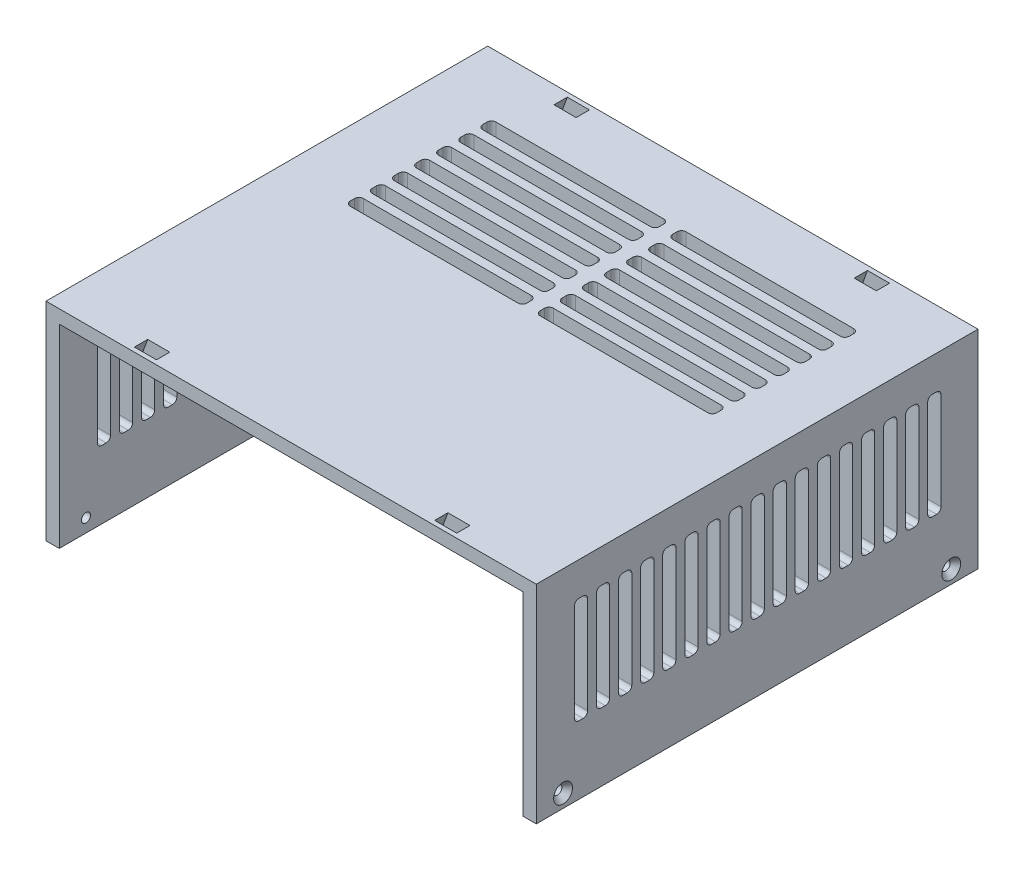
from build123d import *

# Parameters (mm, degrees)
SKETCH1_W                                         = 111
SKETCH1_H                                         = 100
BOSS_EXTRUDE1_DEPTH                               = 47
SKETCH2_W                                         = 105
SKETCH2_H                                         = 44
CUT_EXTRUDE2_DEPTH                                = 124.649706833
CSK_FOR_1_FLAT_HEAD_SOCKET_CAP_SCREW1_D           = 2.0574
CSK_FOR_1_FLAT_HEAD_SOCKET_CAP_SCREW1_DEPTH       = 3
CSK_FOR_1_FLAT_HEAD_SOCKET_CAP_SCREW1_CSINK_D     = 4.2672
CSK_FOR_1_FLAT_HEAD_SOCKET_CAP_SCREW1_CSINK_ANGLE = 82
CUT_EXTRUDE6_DEPTH                                = 131.499042142
CUT_EXTRUDE7_DEPTH                                = 89.256727789
CUT_LOFT2_START                                   = -49
CUT_LOFT2_DEPTH                                   = 3
MIRROR2_START                                     = -49
MIRROR2_AT_THE_SECOND_PLANE_COPY_1_DEPTH          = 3


# Read off the part's stored shape, not the designer's step: Cut-Loft2
with BuildPart() as part:
    # Sketch1 → Boss-Extrude1 (new body)
    with BuildSketch(Plane(origin=(0, 0, 0), x_dir=(1, 0, 0), z_dir=(0, 1, 0))):
        Rectangle(SKETCH1_W, SKETCH1_H)
    extrude(amount=BOSS_EXTRUDE1_DEPTH)

    # Sketch2 → Cut-Extrude2 (cut, through all)
    with BuildSketch(Plane.XY.offset(50)):
        with Locations((0, 22)):
            Rectangle(SKETCH2_W, SKETCH2_H)
    extrude(amount=-CUT_EXTRUDE2_DEPTH, mode=Mode.SUBTRACT)

    # CSK for #1 Flat Head Socket Cap Screw1
    with Locations(Plane.ZY.offset(55.5)):
        with Locations((-43.94, 3), (43.94, 3)):
            csk_for_1_flat_head_socket_cap_screw1 = CounterSinkHole(CSK_FOR_1_FLAT_HEAD_SOCKET_CAP_SCREW1_D / 2, CSK_FOR_1_FLAT_HEAD_SOCKET_CAP_SCREW1_CSINK_D / 2, depth=CSK_FOR_1_FLAT_HEAD_SOCKET_CAP_SCREW1_DEPTH, counter_sink_angle=CSK_FOR_1_FLAT_HEAD_SOCKET_CAP_SCREW1_CSINK_ANGLE)

    # Mirror1: CSK for #1 Flat Head Socket Cap Screw1 across plane
    add(csk_for_1_flat_head_socket_cap_screw1.mirror(Plane(origin=(0, 0, 0), x_dir=(0, 0, 1), z_dir=(1, 0, 0))), mode=Mode.SUBTRACT)

    # Sketch4 → Cut-Extrude6 (cut, through all)
    with BuildSketch(Plane.ZY.offset(55.5)):
        with BuildLine():
            Line((-36.616046788, 38.392706908), (-36.616046788, 16.392706908))
            ThreePointArc((-36.616046788, 16.392706908), (-36.323153569, 15.685600127), (-35.616046788, 15.392706908))
            Line((-35.616046788, 15.392706908), (-34.616046788, 15.392706908))
            ThreePointArc((-34.616046788, 15.392706908), (-33.908940007, 15.685600127), (-33.616046788, 16.392706908))
            Line((-33.616046788, 16.392706908), (-33.616046788, 38.392706908))
            ThreePointArc((-33.616046788, 38.392706908), (-33.908940007, 39.099813689), (-34.616046788, 39.392706908))
            Line((-34.616046788, 39.392706908), (-35.616046788, 39.392706908))
            ThreePointArc((-35.616046788, 39.392706908), (-36.323153569, 39.099813689), (-36.616046788, 38.392706908))
        make_face()
        with BuildLine():
            Line((-40.616046788, 39.392706908), (-39.616046788, 39.392706908))
            ThreePointArc((-39.616046788, 39.392706908), (-38.908940007, 39.099813689), (-38.616046788, 38.392706908))
            Line((-38.616046788, 38.392706908), (-38.616046788, 16.392706908))
            ThreePointArc((-38.616046788, 16.392706908), (-38.908940007, 15.685600127), (-39.616046788, 15.392706908))
            Line((-39.616046788, 15.392706908), (-40.616046788, 15.392706908))
            ThreePointArc((-40.616046788, 15.392706908), (-41.323153569, 15.685600127), (-41.616046788, 16.392706908))
            Line((-41.616046788, 16.392706908), (-41.616046788, 38.392706908))
            ThreePointArc((-41.616046788, 38.392706908), (-41.323153569, 39.099813689), (-40.616046788, 39.392706908))
        make_face()
        with BuildLine():
            Line((-31.616046788, 38.392706908), (-31.616046788, 16.392706908))
            ThreePointArc((-31.616046788, 16.392706908), (-31.323153569, 15.685600127), (-30.616046788, 15.392706908))
            Line((-30.616046788, 15.392706908), (-29.616046788, 15.392706908))
            ThreePointArc((-29.616046788, 15.392706908), (-28.908940007, 15.685600127), (-28.616046788, 16.392706908))
            Line((-28.616046788, 16.392706908), (-28.616046788, 38.392706908))
            ThreePointArc((-28.616046788, 38.392706908), (-28.908940007, 39.099813689), (-29.616046788, 39.392706908))
            Line((-29.616046788, 39.392706908), (-30.616046788, 39.392706908))
            ThreePointArc((-30.616046788, 39.392706908), (-31.323153569, 39.099813689), (-31.616046788, 38.392706908))
        make_face()
        with BuildLine():
            Line((-26.616046788, 38.392706908), (-26.616046788, 16.392706908))
            ThreePointArc((-26.616046788, 16.392706908), (-26.323153569, 15.685600127), (-25.616046788, 15.392706908))
            Line((-25.616046788, 15.392706908), (-24.616046788, 15.392706908))
            ThreePointArc((-24.616046788, 15.392706908), (-23.908940007, 15.685600127), (-23.616046788, 16.392706908))
            Line((-23.616046788, 16.392706908), (-23.616046788, 38.392706908))
            ThreePointArc((-23.616046788, 38.392706908), (-23.908940007, 39.099813689), (-24.616046788, 39.392706908))
            Line((-24.616046788, 39.392706908), (-25.616046788, 39.392706908))
            ThreePointArc((-25.616046788, 39.392706908), (-26.323153569, 39.099813689), (-26.616046788, 38.392706908))
        make_face()
        with BuildLine():
            Line((-21.616046788, 38.392706908), (-21.616046788, 16.392706908))
            ThreePointArc((-21.616046788, 16.392706908), (-21.323153569, 15.685600127), (-20.616046788, 15.392706908))
            Line((-20.616046788, 15.392706908), (-19.616046788, 15.392706908))
            ThreePointArc((-19.616046788, 15.392706908), (-18.908940007, 15.685600127), (-18.616046788, 16.392706908))
            Line((-18.616046788, 16.392706908), (-18.616046788, 38.392706908))
            ThreePointArc((-18.616046788, 38.392706908), (-18.908940007, 39.099813689), (-19.616046788, 39.392706908))
            Line((-19.616046788, 39.392706908), (-20.616046788, 39.392706908))
            ThreePointArc((-20.616046788, 39.392706908), (-21.323153569, 39.099813689), (-21.616046788, 38.392706908))
        make_face()
        with BuildLine():
            Line((-16.616046788, 38.392706908), (-16.616046788, 16.392706908))
            ThreePointArc((-16.616046788, 16.392706908), (-16.323153569, 15.685600127), (-15.616046788, 15.392706908))
            Line((-15.616046788, 15.392706908), (-14.616046788, 15.392706908))
            ThreePointArc((-14.616046788, 15.392706908), (-13.908940007, 15.685600127), (-13.616046788, 16.392706908))
            Line((-13.616046788, 16.392706908), (-13.616046788, 38.392706908))
            ThreePointArc((-13.616046788, 38.392706908), (-13.908940007, 39.099813689), (-14.616046788, 39.392706908))
            Line((-14.616046788, 39.392706908), (-15.616046788, 39.392706908))
            ThreePointArc((-15.616046788, 39.392706908), (-16.323153569, 39.099813689), (-16.616046788, 38.392706908))
        make_face()
        with BuildLine():
            Line((-11.616046788, 38.392706908), (-11.616046788, 16.392706908))
            ThreePointArc((-11.616046788, 16.392706908), (-11.323153569, 15.685600127), (-10.616046788, 15.392706908))
            Line((-10.616046788, 15.392706908), (-9.616046788, 15.392706908))
            ThreePointArc((-9.616046788, 15.392706908), (-8.908940007, 15.685600127), (-8.616046788, 16.392706908))
            Line((-8.616046788, 16.392706908), (-8.616046788, 38.392706908))
            ThreePointArc((-8.616046788, 38.392706908), (-8.908940007, 39.099813689), (-9.616046788, 39.392706908))
            Line((-9.616046788, 39.392706908), (-10.616046788, 39.392706908))
            ThreePointArc((-10.616046788, 39.392706908), (-11.323153569, 39.099813689), (-11.616046788, 38.392706908))
        make_face()
        with BuildLine():
            Line((-6.616046788, 38.392706908), (-6.616046788, 16.392706908))
            ThreePointArc((-6.616046788, 16.392706908), (-6.323153569, 15.685600127), (-5.616046788, 15.392706908))
            Line((-5.616046788, 15.392706908), (-4.616046788, 15.392706908))
            ThreePointArc((-4.616046788, 15.392706908), (-3.908940007, 15.685600127), (-3.616046788, 16.392706908))
            Line((-3.616046788, 16.392706908), (-3.616046788, 38.392706908))
            ThreePointArc((-3.616046788, 38.392706908), (-3.908940007, 39.099813689), (-4.616046788, 39.392706908))
            Line((-4.616046788, 39.392706908), (-5.616046788, 39.392706908))
            ThreePointArc((-5.616046788, 39.392706908), (-6.323153569, 39.099813689), (-6.616046788, 38.392706908))
        make_face()
        with BuildLine():
            Line((-1.616046788, 38.392706908), (-1.616046788, 16.392706908))
            ThreePointArc((-1.616046788, 16.392706908), (-1.323153569, 15.685600127), (-0.616046788, 15.392706908))
            Line((-0.616046788, 15.392706908), (0.383953212, 15.392706908))
            ThreePointArc((0.383953212, 15.392706908), (1.091059993, 15.685600127), (1.383953212, 16.392706908))
            Line((1.383953212, 16.392706908), (1.383953212, 38.392706908))
            ThreePointArc((1.383953212, 38.392706908), (1.091059993, 39.099813689), (0.383953212, 39.392706908))
            Line((0.383953212, 39.392706908), (-0.616046788, 39.392706908))
            ThreePointArc((-0.616046788, 39.392706908), (-1.323153569, 39.099813689), (-1.616046788, 38.392706908))
        make_face()
        with BuildLine():
            Line((3.383953212, 38.392706908), (3.383953212, 16.392706908))
            ThreePointArc((3.383953212, 16.392706908), (3.676846431, 15.685600127), (4.383953212, 15.392706908))
            Line((4.383953212, 15.392706908), (5.383953212, 15.392706908))
            ThreePointArc((5.383953212, 15.392706908), (6.091059993, 15.685600127), (6.383953212, 16.392706908))
            Line((6.383953212, 16.392706908), (6.383953212, 38.392706908))
            ThreePointArc((6.383953212, 38.392706908), (6.091059993, 39.099813689), (5.383953212, 39.392706908))
            Line((5.383953212, 39.392706908), (4.383953212, 39.392706908))
            ThreePointArc((4.383953212, 39.392706908), (3.676846431, 39.099813689), (3.383953212, 38.392706908))
        make_face()
        with BuildLine():
            Line((8.383953212, 38.392706908), (8.383953212, 16.392706908))
            ThreePointArc((8.383953212, 16.392706908), (8.676846431, 15.685600127), (9.383953212, 15.392706908))
            Line((9.383953212, 15.392706908), (10.383953212, 15.392706908))
            ThreePointArc((10.383953212, 15.392706908), (11.091059993, 15.685600127), (11.383953212, 16.392706908))
            Line((11.383953212, 16.392706908), (11.383953212, 38.392706908))
            ThreePointArc((11.383953212, 38.392706908), (11.091059993, 39.099813689), (10.383953212, 39.392706908))
            Line((10.383953212, 39.392706908), (9.383953212, 39.392706908))
            ThreePointArc((9.383953212, 39.392706908), (8.676846431, 39.099813689), (8.383953212, 38.392706908))
        make_face()
        with BuildLine():
            Line((13.383953212, 38.392706908), (13.383953212, 16.392706908))
            ThreePointArc((13.383953212, 16.392706908), (13.676846431, 15.685600127), (14.383953212, 15.392706908))
            Line((14.383953212, 15.392706908), (15.383953212, 15.392706908))
            ThreePointArc((15.383953212, 15.392706908), (16.091059993, 15.685600127), (16.383953212, 16.392706908))
            Line((16.383953212, 16.392706908), (16.383953212, 38.392706908))
            ThreePointArc((16.383953212, 38.392706908), (16.091059993, 39.099813689), (15.383953212, 39.392706908))
            Line((15.383953212, 39.392706908), (14.383953212, 39.392706908))
            ThreePointArc((14.383953212, 39.392706908), (13.676846431, 39.099813689), (13.383953212, 38.392706908))
        make_face()
        with BuildLine():
            Line((18.383953212, 38.392706908), (18.383953212, 16.392706908))
            ThreePointArc((18.383953212, 16.392706908), (18.676846431, 15.685600127), (19.383953212, 15.392706908))
            Line((19.383953212, 15.392706908), (20.383953212, 15.392706908))
            ThreePointArc((20.383953212, 15.392706908), (21.091059993, 15.685600127), (21.383953212, 16.392706908))
            Line((21.383953212, 16.392706908), (21.383953212, 38.392706908))
            ThreePointArc((21.383953212, 38.392706908), (21.091059993, 39.099813689), (20.383953212, 39.392706908))
            Line((20.383953212, 39.392706908), (19.383953212, 39.392706908))
            ThreePointArc((19.383953212, 39.392706908), (18.676846431, 39.099813689), (18.383953212, 38.392706908))
        make_face()
        with BuildLine():
            Line((23.383953212, 38.392706908), (23.383953212, 16.392706908))
            ThreePointArc((23.383953212, 16.392706908), (23.676846431, 15.685600127), (24.383953212, 15.392706908))
            Line((24.383953212, 15.392706908), (25.383953212, 15.392706908))
            ThreePointArc((25.383953212, 15.392706908), (26.091059993, 15.685600127), (26.383953212, 16.392706908))
            Line((26.383953212, 16.392706908), (26.383953212, 38.392706908))
            ThreePointArc((26.383953212, 38.392706908), (26.091059993, 39.099813689), (25.383953212, 39.392706908))
            Line((25.383953212, 39.392706908), (24.383953212, 39.392706908))
            ThreePointArc((24.383953212, 39.392706908), (23.676846431, 39.099813689), (23.383953212, 38.392706908))
        make_face()
        with BuildLine():
            Line((28.383953212, 38.392706908), (28.383953212, 16.392706908))
            ThreePointArc((28.383953212, 16.392706908), (28.676846431, 15.685600127), (29.383953212, 15.392706908))
            Line((29.383953212, 15.392706908), (30.383953212, 15.392706908))
            ThreePointArc((30.383953212, 15.392706908), (31.091059993, 15.685600127), (31.383953212, 16.392706908))
            Line((31.383953212, 16.392706908), (31.383953212, 38.392706908))
            ThreePointArc((31.383953212, 38.392706908), (31.091059993, 39.099813689), (30.383953212, 39.392706908))
            Line((30.383953212, 39.392706908), (29.383953212, 39.392706908))
            ThreePointArc((29.383953212, 39.392706908), (28.676846431, 39.099813689), (28.383953212, 38.392706908))
        make_face()
        with BuildLine():
            Line((33.383953212, 38.392706908), (33.383953212, 16.392706908))
            ThreePointArc((33.383953212, 16.392706908), (33.676846431, 15.685600127), (34.383953212, 15.392706908))
            Line((34.383953212, 15.392706908), (35.383953212, 15.392706908))
            ThreePointArc((35.383953212, 15.392706908), (36.091059993, 15.685600127), (36.383953212, 16.392706908))
            Line((36.383953212, 16.392706908), (36.383953212, 38.392706908))
            ThreePointArc((36.383953212, 38.392706908), (36.091059993, 39.099813689), (35.383953212, 39.392706908))
            Line((35.383953212, 39.392706908), (34.383953212, 39.392706908))
            ThreePointArc((34.383953212, 39.392706908), (33.676846431, 39.099813689), (33.383953212, 38.392706908))
        make_face()
        with BuildLine():
            Line((38.383953212, 38.392706908), (38.383953212, 16.392706908))
            ThreePointArc((38.383953212, 16.392706908), (38.676846431, 15.685600127), (39.383953212, 15.392706908))
            Line((39.383953212, 15.392706908), (40.383953212, 15.392706908))
            ThreePointArc((40.383953212, 15.392706908), (41.091059993, 15.685600127), (41.383953212, 16.392706908))
            Line((41.383953212, 16.392706908), (41.383953212, 38.392706908))
            ThreePointArc((41.383953212, 38.392706908), (41.091059993, 39.099813689), (40.383953212, 39.392706908))
            Line((40.383953212, 39.392706908), (39.383953212, 39.392706908))
            ThreePointArc((39.383953212, 39.392706908), (38.676846431, 39.099813689), (38.383953212, 38.392706908))
        make_face()
    extrude(amount=-CUT_EXTRUDE6_DEPTH, mode=Mode.SUBTRACT)

    # Sketch7 → Cut-Extrude7 (cut, through all)
    with BuildSketch(Plane(origin=(0, 47, 0), x_dir=(1, 0, 0), z_dir=(0, 1, 0))):
        with BuildLine():
            Line((-39.682233547, 36.038845235), (-1.682233547, 36.038845235))
            ThreePointArc((-1.682233547, 36.038845235), (-0.975126766, 35.745952016), (-0.682233547, 35.038845235))
            Line((-0.682233547, 35.038845235), (-0.682233547, 34.038845235))
            ThreePointArc((-0.682233547, 34.038845235), (-0.975126766, 33.331738453), (-1.682233547, 33.038845235))
            Line((-1.682233547, 33.038845235), (-39.682233547, 33.038845235))
            ThreePointArc((-39.682233547, 33.038845235), (-40.389340328, 33.331738453), (-40.682233547, 34.038845235))
            Line((-40.682233547, 34.038845235), (-40.682233547, 35.038845235))
            ThreePointArc((-40.682233547, 35.038845235), (-40.389340328, 35.745952016), (-39.682233547, 36.038845235))
        make_face()
        with BuildLine():
            Line((2.317766453, 35.038845235), (2.317766453, 34.038845235))
            ThreePointArc((2.317766453, 34.038845235), (2.610659672, 33.331738453), (3.317766453, 33.038845235))
            Line((3.317766453, 33.038845235), (41.317766453, 33.038845235))
            ThreePointArc((41.317766453, 33.038845235), (42.024873234, 33.331738453), (42.317766453, 34.038845235))
            Line((42.317766453, 34.038845235), (42.317766453, 35.038845235))
            ThreePointArc((42.317766453, 35.038845235), (42.024873234, 35.745952016), (41.317766453, 36.038845235))
            Line((41.317766453, 36.038845235), (3.317766453, 36.038845235))
            ThreePointArc((3.317766453, 36.038845235), (2.610659672, 35.745952016), (2.317766453, 35.038845235))
        make_face()
        with BuildLine():
            Line((2.317766453, 30.038845235), (2.317766453, 29.038845235))
            ThreePointArc((2.317766453, 29.038845235), (2.610659672, 28.331738453), (3.317766453, 28.038845235))
            Line((3.317766453, 28.038845235), (41.317766453, 28.038845235))
            ThreePointArc((41.317766453, 28.038845235), (42.024873234, 28.331738453), (42.317766453, 29.038845235))
            Line((42.317766453, 29.038845235), (42.317766453, 30.038845235))
            ThreePointArc((42.317766453, 30.038845235), (42.024873234, 30.745952016), (41.317766453, 31.038845235))
            Line((41.317766453, 31.038845235), (3.317766453, 31.038845235))
            ThreePointArc((3.317766453, 31.038845235), (2.610659672, 30.745952016), (2.317766453, 30.038845235))
        make_face()
        with BuildLine():
            Line((2.317766453, 25.038845235), (2.317766453, 24.038845235))
            ThreePointArc((2.317766453, 24.038845235), (2.610659672, 23.331738453), (3.317766453, 23.038845235))
            Line((3.317766453, 23.038845235), (41.317766453, 23.038845235))
            ThreePointArc((41.317766453, 23.038845235), (42.024873234, 23.331738453), (42.317766453, 24.038845235))
            Line((42.317766453, 24.038845235), (42.317766453, 25.038845235))
            ThreePointArc((42.317766453, 25.038845235), (42.024873234, 25.745952016), (41.317766453, 26.038845235))
            Line((41.317766453, 26.038845235), (3.317766453, 26.038845235))
            ThreePointArc((3.317766453, 26.038845235), (2.610659672, 25.745952016), (2.317766453, 25.038845235))
        make_face()
        with BuildLine():
            Line((2.317766453, 20.038845235), (2.317766453, 19.038845235))
            ThreePointArc((2.317766453, 19.038845235), (2.610659672, 18.331738453), (3.317766453, 18.038845235))
            Line((3.317766453, 18.038845235), (41.317766453, 18.038845235))
            ThreePointArc((41.317766453, 18.038845235), (42.024873234, 18.331738453), (42.317766453, 19.038845235))
            Line((42.317766453, 19.038845235), (42.317766453, 20.038845235))
            ThreePointArc((42.317766453, 20.038845235), (42.024873234, 20.745952016), (41.317766453, 21.038845235))
            Line((41.317766453, 21.038845235), (3.317766453, 21.038845235))
            ThreePointArc((3.317766453, 21.038845235), (2.610659672, 20.745952016), (2.317766453, 20.038845235))
        make_face()
        with BuildLine():
            Line((2.317766453, 15.038845235), (2.317766453, 14.038845235))
            ThreePointArc((2.317766453, 14.038845235), (2.610659672, 13.331738453), (3.317766453, 13.038845235))
            Line((3.317766453, 13.038845235), (41.317766453, 13.038845235))
            ThreePointArc((41.317766453, 13.038845235), (42.024873234, 13.331738453), (42.317766453, 14.038845235))
            Line((42.317766453, 14.038845235), (42.317766453, 15.038845235))
            ThreePointArc((42.317766453, 15.038845235), (42.024873234, 15.745952016), (41.317766453, 16.038845235))
            Line((41.317766453, 16.038845235), (3.317766453, 16.038845235))
            ThreePointArc((3.317766453, 16.038845235), (2.610659672, 15.745952016), (2.317766453, 15.038845235))
        make_face()
        with BuildLine():
            Line((2.317766453, 10.038845235), (2.317766453, 9.038845235))
            ThreePointArc((2.317766453, 9.038845235), (2.610659672, 8.331738453), (3.317766453, 8.038845235))
            Line((3.317766453, 8.038845235), (41.317766453, 8.038845235))
            ThreePointArc((41.317766453, 8.038845235), (42.024873234, 8.331738453), (42.317766453, 9.038845235))
            Line((42.317766453, 9.038845235), (42.317766453, 10.038845235))
            ThreePointArc((42.317766453, 10.038845235), (42.024873234, 10.745952016), (41.317766453, 11.038845235))
            Line((41.317766453, 11.038845235), (3.317766453, 11.038845235))
            ThreePointArc((3.317766453, 11.038845235), (2.610659672, 10.745952016), (2.317766453, 10.038845235))
        make_face()
        with BuildLine():
            Line((2.317766453, 5.038845235), (2.317766453, 4.038845235))
            ThreePointArc((2.317766453, 4.038845235), (2.610659672, 3.331738453), (3.317766453, 3.038845235))
            Line((3.317766453, 3.038845235), (41.317766453, 3.038845235))
            ThreePointArc((41.317766453, 3.038845235), (42.024873234, 3.331738453), (42.317766453, 4.038845235))
            Line((42.317766453, 4.038845235), (42.317766453, 5.038845235))
            ThreePointArc((42.317766453, 5.038845235), (42.024873234, 5.745952016), (41.317766453, 6.038845235))
            Line((41.317766453, 6.038845235), (3.317766453, 6.038845235))
            ThreePointArc((3.317766453, 6.038845235), (2.610659672, 5.745952016), (2.317766453, 5.038845235))
        make_face()
        with BuildLine():
            Line((-40.682233547, 30.038845235), (-40.682233547, 29.038845235))
            ThreePointArc((-40.682233547, 29.038845235), (-40.389340328, 28.331738453), (-39.682233547, 28.038845235))
            Line((-39.682233547, 28.038845235), (-1.682233547, 28.038845235))
            ThreePointArc((-1.682233547, 28.038845235), (-0.975126766, 28.331738453), (-0.682233547, 29.038845235))
            Line((-0.682233547, 29.038845235), (-0.682233547, 30.038845235))
            ThreePointArc((-0.682233547, 30.038845235), (-0.975126766, 30.745952016), (-1.682233547, 31.038845235))
            Line((-1.682233547, 31.038845235), (-39.682233547, 31.038845235))
            ThreePointArc((-39.682233547, 31.038845235), (-40.389340328, 30.745952016), (-40.682233547, 30.038845235))
        make_face()
        with BuildLine():
            Line((-40.682233547, 25.038845235), (-40.682233547, 24.038845235))
            ThreePointArc((-40.682233547, 24.038845235), (-40.389340328, 23.331738453), (-39.682233547, 23.038845235))
            Line((-39.682233547, 23.038845235), (-1.682233547, 23.038845235))
            ThreePointArc((-1.682233547, 23.038845235), (-0.975126766, 23.331738453), (-0.682233547, 24.038845235))
            Line((-0.682233547, 24.038845235), (-0.682233547, 25.038845235))
            ThreePointArc((-0.682233547, 25.038845235), (-0.975126766, 25.745952016), (-1.682233547, 26.038845235))
            Line((-1.682233547, 26.038845235), (-39.682233547, 26.038845235))
            ThreePointArc((-39.682233547, 26.038845235), (-40.389340328, 25.745952016), (-40.682233547, 25.038845235))
        make_face()
        with BuildLine():
            Line((-40.682233547, 20.038845235), (-40.682233547, 19.038845235))
            ThreePointArc((-40.682233547, 19.038845235), (-40.389340328, 18.331738453), (-39.682233547, 18.038845235))
            Line((-39.682233547, 18.038845235), (-1.682233547, 18.038845235))
            ThreePointArc((-1.682233547, 18.038845235), (-0.975126766, 18.331738453), (-0.682233547, 19.038845235))
            Line((-0.682233547, 19.038845235), (-0.682233547, 20.038845235))
            ThreePointArc((-0.682233547, 20.038845235), (-0.975126766, 20.745952016), (-1.682233547, 21.038845235))
            Line((-1.682233547, 21.038845235), (-39.682233547, 21.038845235))
            ThreePointArc((-39.682233547, 21.038845235), (-40.389340328, 20.745952016), (-40.682233547, 20.038845235))
        make_face()
        with BuildLine():
            Line((-40.682233547, 15.038845235), (-40.682233547, 14.038845235))
            ThreePointArc((-40.682233547, 14.038845235), (-40.389340328, 13.331738453), (-39.682233547, 13.038845235))
            Line((-39.682233547, 13.038845235), (-1.682233547, 13.038845235))
            ThreePointArc((-1.682233547, 13.038845235), (-0.975126766, 13.331738453), (-0.682233547, 14.038845235))
            Line((-0.682233547, 14.038845235), (-0.682233547, 15.038845235))
            ThreePointArc((-0.682233547, 15.038845235), (-0.975126766, 15.745952016), (-1.682233547, 16.038845235))
            Line((-1.682233547, 16.038845235), (-39.682233547, 16.038845235))
            ThreePointArc((-39.682233547, 16.038845235), (-40.389340328, 15.745952016), (-40.682233547, 15.038845235))
        make_face()
        with BuildLine():
            Line((-40.682233547, 10.038845235), (-40.682233547, 9.038845235))
            ThreePointArc((-40.682233547, 9.038845235), (-40.389340328, 8.331738453), (-39.682233547, 8.038845235))
            Line((-39.682233547, 8.038845235), (-1.682233547, 8.038845235))
            ThreePointArc((-1.682233547, 8.038845235), (-0.975126766, 8.331738453), (-0.682233547, 9.038845235))
            Line((-0.682233547, 9.038845235), (-0.682233547, 10.038845235))
            ThreePointArc((-0.682233547, 10.038845235), (-0.975126766, 10.745952016), (-1.682233547, 11.038845235))
            Line((-1.682233547, 11.038845235), (-39.682233547, 11.038845235))
            ThreePointArc((-39.682233547, 11.038845235), (-40.389340328, 10.745952016), (-40.682233547, 10.038845235))
        make_face()
        with BuildLine():
            Line((-40.682233547, 5.038845235), (-40.682233547, 4.038845235))
            ThreePointArc((-40.682233547, 4.038845235), (-40.389340328, 3.331738453), (-39.682233547, 3.038845235))
            Line((-39.682233547, 3.038845235), (-1.682233547, 3.038845235))
            ThreePointArc((-1.682233547, 3.038845235), (-0.975126766, 3.331738453), (-0.682233547, 4.038845235))
            Line((-0.682233547, 4.038845235), (-0.682233547, 5.038845235))
            ThreePointArc((-0.682233547, 5.038845235), (-0.975126766, 5.745952016), (-1.682233547, 6.038845235))
            Line((-1.682233547, 6.038845235), (-39.682233547, 6.038845235))
            ThreePointArc((-39.682233547, 6.038845235), (-40.389340328, 5.745952016), (-40.682233547, 5.038845235))
        make_face()
    extrude(amount=-CUT_EXTRUDE7_DEPTH, mode=Mode.SUBTRACT)

    # Cut-Loft2 outline → Cut-Loft2 (cut)
    with BuildSketch(Plane.XY.offset(CUT_LOFT2_START)):
        Polygon((36.48, 47), (31.48, 47), (30.4, 44), (37.58, 44), align=None)
    cut_loft2 = extrude(amount=CUT_LOFT2_DEPTH, mode=Mode.SUBTRACT)

    # Mirror2: Cut-Loft2 across plane
    add(cut_loft2.mirror(Plane.XY), mode=Mode.SUBTRACT)

    # Mirror2 at the second plane: Cut-Loft2 across plane
    add(cut_loft2.mirror(Plane(origin=(0, 0, 0), x_dir=(0, 0, 1), z_dir=(1, 0, 0))), mode=Mode.SUBTRACT)

    # Mirror2 at the second plane copy 1 sketc → Mirror2 at the second plane copy 1 (cut)
    with BuildSketch(Plane(origin=(0, 0, 0), x_dir=(-1, 0, 0), z_dir=(0, 0, -1)).offset(MIRROR2_START)):
        Polygon((36.48, 47), (31.48, 47), (30.4, 44), (37.58, 44), align=None)
    extrude(amount=MIRROR2_AT_THE_SECOND_PLANE_COPY_1_DEPTH, mode=Mode.SUBTRACT)


solid = part.part
